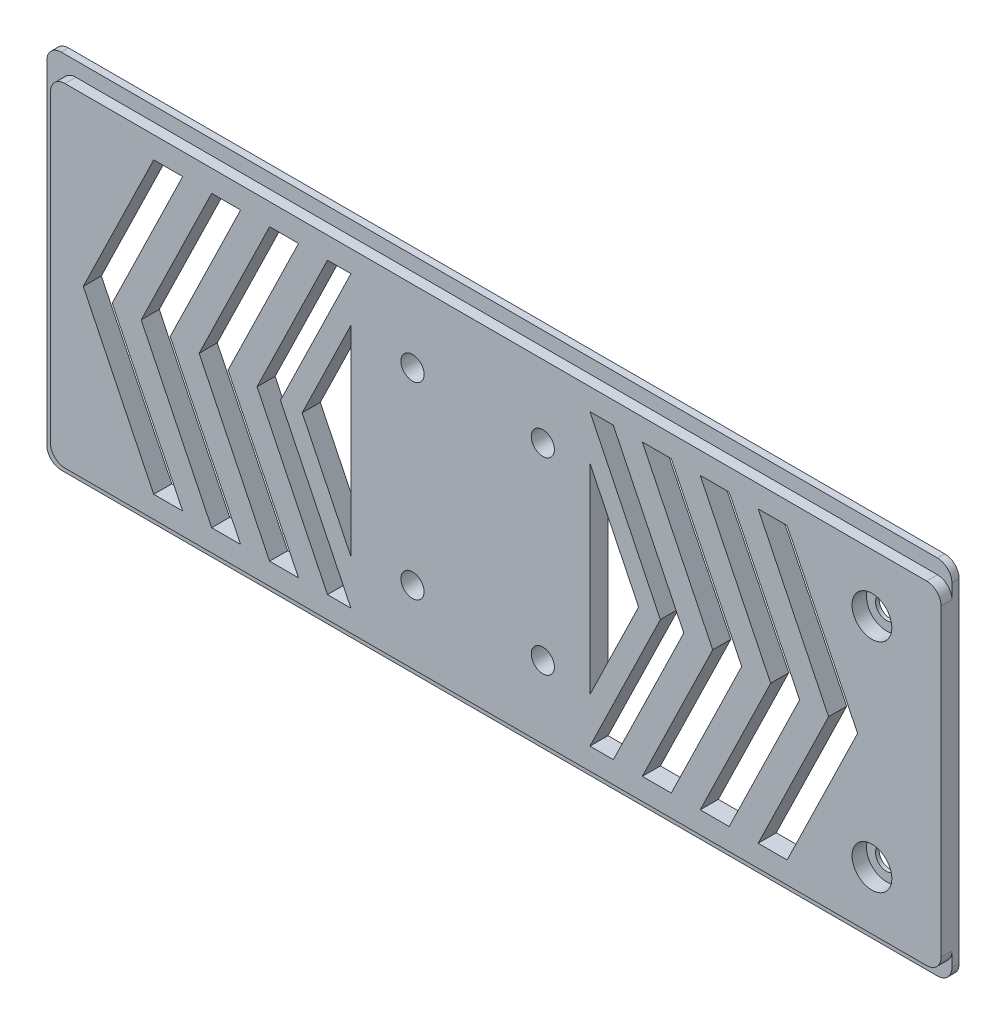
from build123d import *

# Parameters (mm, degrees)
ESBO_O1_W                  = 125
ESBO_O1_H                  = 50
RESSALTO_EXTRUS_O1_DEPTH   = 2.5
ESBO_O2_R                  = 1.6
CORTE_EXTRUS_O2_DEPTH      = 2.5
CORTE_EXTRUS_O3_DEPTH      = 1.5
CORTE_EXTRUS_O5_DEPTH      = 113.726994752
CORTE_EXTRUS_O5_DEPTH_BACK = 113.726994752
ESBO_O12_R                 = 2.75
CORTE_EXTRUS_O6_DEPTH      = 2
ESBO_O19_R                 = 1.5
CORTE_EXTRUS_O7_DEPTH      = 2
FILETE1_R                  = 2


with BuildPart() as part:
    # Esboço1 → Ressalto-extrusão1 (new body)
    with BuildSketch(Plane.XY):
        with Locations((44.657564369, 9.905325444)):
            Rectangle(ESBO_O1_W, ESBO_O1_H)
    extrude(amount=RESSALTO_EXTRUS_O1_DEPTH)

    # Esboço2 → Corte-extrusão2 (cut)
    with BuildSketch(Plane.XY.offset(2.5)):
        with Locations((34.157564369, 22.905325444)):
            Circle(ESBO_O2_R)
        with Locations(Location((34.157564369, -3.094674556, 0), (0, 0, 180))):
            Circle(ESBO_O2_R)
        with Locations((52.157564369, -3.094674556)):
            Circle(ESBO_O2_R)
        with Locations(Location((52.157564369, 22.905325444, 0), (0, 0, 180))):
            Circle(ESBO_O2_R)
    extrude(amount=-CORTE_EXTRUS_O2_DEPTH, mode=Mode.SUBTRACT)

    # Esboço3 → Corte-extrusão3 (cut)
    with BuildSketch(Plane.XY.offset(2.5)):
        Polygon((-17.842435631, 32.905325444), (-17.842435631, 9.905325444), (-15.842435631, 9.905325444), (-15.842435631, 32.905325444), (107.157564369, 32.905325444), (107.157564369, 34.905325444), (-15.842435631, 34.905325444), (-17.842435631, 34.905325444), align=None)
        Polygon((-15.842435631, 9.905325444), (-17.842435631, 9.905325444), (-17.842435631, -13.094674556), (-17.842435631, -15.094674556), (-15.842435631, -15.094674556), (107.157564369, -15.094674556), (107.157564369, -13.094674556), (-15.842435631, -13.094674556), align=None)
    extrude(amount=-CORTE_EXTRUS_O3_DEPTH, mode=Mode.SUBTRACT)

    # Esboço4 → Corte-extrusão5 (cut, two sides: drawn at the far end of the back side and taken through both)
    with BuildSketch(Plane.XY.offset(2.5).offset(-CORTE_EXTRUS_O5_DEPTH_BACK)):
        Polygon((15.925055292, 9.905325444), (25.654023464, 29.905325444), (22.419553485, 29.905325444), (12.690585312, 9.905325444), (22.419553485, -10.094674556), (25.654023464, -10.094674556), align=None)
        Polygon((25.654023464, 23.738176067), (18.925055292, 9.905325444), (25.654023464, -3.927525179), align=None)
        Polygon((8.690585312, 9.905325444), (18.419553485, 29.905325444), (14.419553485, 29.905325444), (4.690585312, 9.905325444), (14.419553485, -10.094674556), (18.419553485, -10.094674556), align=None)
        Polygon((0.690585312, 9.905325444), (10.419553485, 29.905325444), (6.419553485, 29.905325444), (-3.309414688, 9.905325444), (6.419553485, -10.094674556), (10.419553485, -10.094674556), align=None)
        Polygon((-7.309414688, 9.905325444), (2.419553485, 29.905325444), (-1.580446515, 29.905325444), (-11.309414688, 9.905325444), (-1.580446515, -10.094674556), (2.419553485, -10.094674556), align=None)
        Polygon((85.895575254, -10.094674556), (95.624543426, 9.905325444), (85.895575254, 29.905325444), (81.895575254, 29.905325444), (91.624543426, 9.905325444), (81.895575254, -10.094674556), align=None)
        Polygon((77.895575254, -10.094674556), (87.624543426, 9.905325444), (77.895575254, 29.905325444), (73.895575254, 29.905325444), (83.624543426, 9.905325444), (73.895575254, -10.094674556), align=None)
        Polygon((69.895575254, -10.094674556), (79.624543426, 9.905325444), (69.895575254, 29.905325444), (65.895575254, 29.905325444), (75.624543426, 9.905325444), (65.895575254, -10.094674556), align=None)
        Polygon((71.624543426, 9.905325444), (61.895575254, 29.905325444), (58.661105274, 29.905325444), (68.390073446, 9.905325444), (58.661105274, -10.094674556), (61.895575254, -10.094674556), align=None)
        Polygon((65.390073446, 9.905325444), (58.661105274, -3.927525179), (58.661105274, 23.738176067), align=None)
    extrude(amount=CORTE_EXTRUS_O5_DEPTH + CORTE_EXTRUS_O5_DEPTH_BACK, mode=Mode.SUBTRACT)

    # Esboço12 → Corte-extrusão6 (cut)
    with BuildSketch(Plane.XY.offset(2.5)):
        with Locations((97.607564369, 24.905325444)):
            Circle(ESBO_O12_R)
        with Locations((97.607564369, -5.094674556)):
            Circle(ESBO_O12_R)
    extrude(amount=-CORTE_EXTRUS_O6_DEPTH, mode=Mode.SUBTRACT)

    # Esboço19 → Corte-extrusão7 (cut)
    with BuildSketch(Plane.XY.offset(0.5)):
        with Locations((97.607564369, 24.905325444)):
            Circle(ESBO_O19_R)
        with Locations((97.607564369, -5.094674556)):
            Circle(ESBO_O19_R)
    extrude(amount=-CORTE_EXTRUS_O7_DEPTH, mode=Mode.SUBTRACT)

    # Filete1
    filete1_edges = [part.edges().sort_by_distance(p)[0] for p in [
        (-17.842435631, -15.094674556, 0.5),
        (-15.842435631, -13.094674556, 1.75),
        (-17.842435631, 34.905325444, 0.5),
        (-15.842435631, 32.905325444, 1.75),
        (107.157564369, -15.094674556, 0.5),
        (107.157564369, -13.094674556, 1.75),
        (107.157564369, 32.905325444, 1.75),
        (107.157564369, 34.905325444, 0.5),
    ]]
    fillet(filete1_edges, radius=FILETE1_R - 0.0001)  # a hair under: the kernel refuses the full size


solid = part.part
